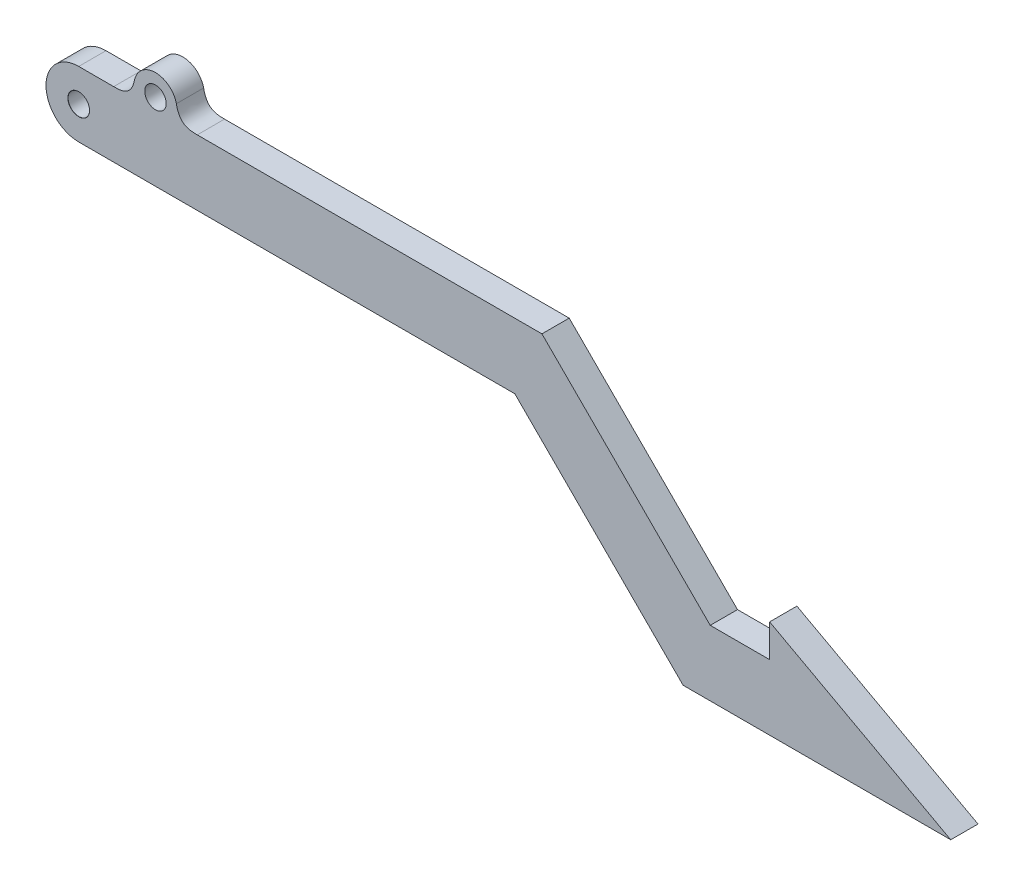
from build123d import *

# Parameters (mm, degrees)
SKETCH1_R                       = 7.62
BOSS_EXTRUDE1_DEPTH             = 6.35
F_5_0MM_DOWEL_HOLE1_D           = 5
F_5_0MM_DOWEL_HOLE1_CSINK_D     = 5.05
F_5_0MM_DOWEL_HOLE1_CSINK_ANGLE = 90
BOSS_EXTRUDE3_DEPTH             = 6.35
FILLET2_DEPTH                   = 6.35
F_5_0MM_DOWEL_HOLE3_D           = 5


with BuildPart() as part:
    # Sketch1 → Boss-Extrude1 (new body)
    with BuildSketch(Plane.XY):
        with BuildLine():
            ThreePointArc((-50.301924176, 44.54348243), (-52.533770503, 39.155328757), (-57.921924176, 36.92348243))
            Line((-57.921924176, 36.92348243), (43.628363104, 36.92348243))
            Line((43.628363104, 36.92348243), (82.81675676, -2.264911225))
            Line((82.81675676, -2.264911225), (145.132424058, -2.264911225))
            Line((145.132424058, -2.264911225), (102.962916525, 20.595088775))
            Line((102.962916525, 20.595088775), (102.962916525, 12.975088775))
            Line((102.962916525, 12.975088775), (89.12937145, 12.975088775))
            Line((89.12937145, 12.975088775), (49.940977795, 52.16348243))
            Line((49.940977795, 52.16348243), (-57.921924176, 52.16348243))
            ThreePointArc((-57.921924176, 52.16348243), (-52.533770503, 49.931636103), (-50.301924176, 44.54348243))
        make_face()
        with Locations((-57.921924176, 44.54348243)):
            Circle(SKETCH1_R)
    extrude(amount=BOSS_EXTRUDE1_DEPTH)

    # Ø5.0mm Dowel Hole1 (through all)
    with Locations(Plane.XY.offset(6.35)):
        with Locations((-57.921924176, 44.54348243)):
            CounterSinkHole(F_5_0MM_DOWEL_HOLE1_D / 2, F_5_0MM_DOWEL_HOLE1_CSINK_D / 2, counter_sink_angle=F_5_0MM_DOWEL_HOLE1_CSINK_ANGLE)

    # Sketch4 → Boss-Extrude3 (add)
    with BuildSketch(Plane.XY):
        with BuildLine():
            Line((-45.049324905, 52.16348243), (-35.049324905, 52.16348243))
            Line((-35.049324905, 52.16348243), (-35.049324905, 54.86223243))
            ThreePointArc((-35.049324905, 54.86223243), (-40.049324905, 59.86223243), (-45.049324905, 54.86223243))
            Line((-45.049324905, 54.86223243), (-45.049324905, 52.16348243))
        make_face()
    extrude(amount=BOSS_EXTRUDE3_DEPTH)

    # Fillet2: read off the stored shape, not the designer's step
    # Fillet2 outline → Fillet2 (add)
    with BuildSketch(Plane.XY):
        with BuildLine():
            Line((-35.049324905, 52.16348243), (-30.317714122, 52.16348243))
            add(Edge.make_bspline(
                [(-30.317714122, 52.16348243), (-31.005571174, 52.16348243), (-31.693428226, 52.16348243), (-33.124030191, 52.387599223), (-34.337985858, 53.16866407), (-34.986310807, 54.947810993), (-35.077384253, 55.56402873), (-35.183519514, 56.01285743)],
                knots=[0, 0, 0, 0, 0, 0, 0.5, 0.5, 1, 1, 1, 1, 1, 1], degree=5))
            ThreePointArc((-35.183519514, 56.01285743), (-35.08298687, 55.441444413), (-35.049324905, 54.86223243))
            Line((-35.049324905, 54.86223243), (-35.049324905, 52.16348243))
        make_face()
        with BuildLine():
            ThreePointArc((-45.049324905, 54.86223243), (-45.01566294, 55.441444413), (-44.915130297, 56.01285743))
            add(Edge.make_bspline(
                [(-44.915130297, 56.01285743), (-45.021265558, 55.56402873), (-45.112339003, 54.947810993), (-45.760663953, 53.16866407), (-46.97461962, 52.387599223), (-48.405221585, 52.16348243), (-49.093078637, 52.16348243), (-49.780935689, 52.16348243)],
                knots=[0, 0, 0, 0, 0, 0, 0.5, 0.5, 1, 1, 1, 1, 1, 1], degree=5))
            Line((-49.780935689, 52.16348243), (-45.049324905, 52.16348243))
            Line((-45.049324905, 52.16348243), (-45.049324905, 54.86223243))
        make_face()
    extrude(amount=FILLET2_DEPTH)

    # Ø5.0mm Dowel Hole3 (through all)
    with Locations(Plane.XY.offset(6.35)):
        with Locations((-40.049324905, 54.86223243)):
            Hole(F_5_0MM_DOWEL_HOLE3_D / 2)


solid = part.part
